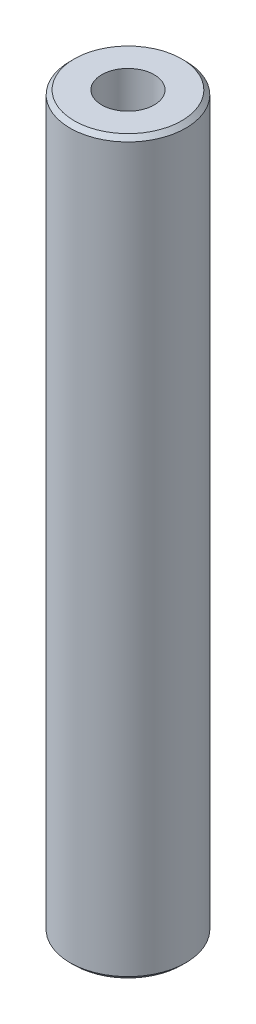
from build123d import *
from OCP.BRepFilletAPI import BRepFilletAPI_MakeChamfer

# Parameters (mm, degrees)
SKETCH1_R           = 47.5
BOSS_EXTRUDE1_DEPTH = 600
SKETCH2_R           = 21.530699467
CUT_EXTRUDE1_DEPTH  = 604.748706003
CHAMFER1_SIZE       = 3.480772675
CHAMFER1_SIZE2      = 3.452416606


with BuildPart() as part:
    # Sketch1 → Boss-Extrude1 (new body)
    with BuildSketch(Plane(origin=(0, 0, 0), x_dir=(1, 0, 0), z_dir=(0, 1, 0))):
        Circle(SKETCH1_R)
    extrude(amount=BOSS_EXTRUDE1_DEPTH)

    # Sketch2 → Cut-Extrude1 (cut, through all)
    with BuildSketch(Plane(origin=(0, 0, 0), x_dir=(1, 0, 0), z_dir=(0, 1, 0))):
        Circle(SKETCH2_R)
    extrude(amount=CUT_EXTRUDE1_DEPTH, mode=Mode.SUBTRACT)

    # Chamfer1: one chamfer whose edges measure the first distance from different faces: ONE call of the kernel's chamfer builder (chamfer() names one face for all edges)
    chamfer1_edges_1 = [part.edges().sort_by_distance(p)[0] for p in [
        (-47.5, 600, 0),
    ]]
    chamfer1_side_1 = [part.faces().sort_by_distance(p)[0] for p in [
        (-47.5, 300, 0),
    ]]
    chamfer1_edges_2 = [part.edges().sort_by_distance(p)[0] for p in [
        (-47.5, 0, 0),
    ]]
    chamfer1_side_2 = [part.faces().sort_by_distance(p)[0] for p in [
        (-46.156497116, 0, 0),
    ]]
    chamfer1 = BRepFilletAPI_MakeChamfer(part.part.solid().wrapped)
    for e in chamfer1_edges_1:
        chamfer1.Add(CHAMFER1_SIZE, CHAMFER1_SIZE2, e.wrapped, chamfer1_side_1[0].wrapped)  # the first distance lies on this face
    for e in chamfer1_edges_2:
        chamfer1.Add(CHAMFER1_SIZE, CHAMFER1_SIZE2, e.wrapped, chamfer1_side_2[0].wrapped)  # the first distance lies on this face
    add(Compound.cast(chamfer1.Shape()), mode=Mode.REPLACE)


solid = part.part
